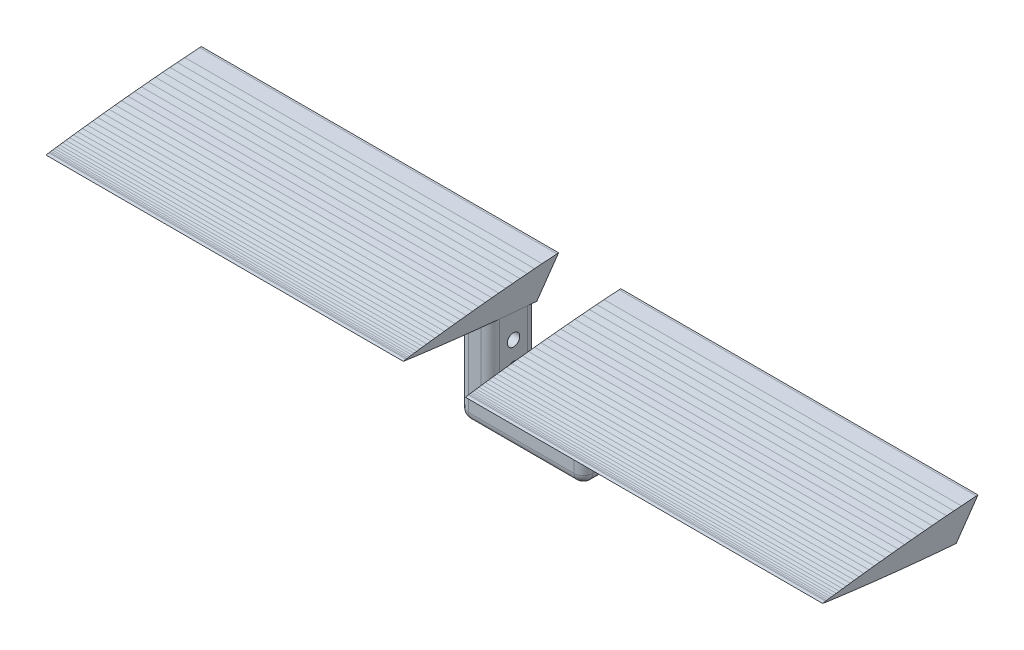
from build123d import *

# Parameters (mm, degrees)
BOSS_EXTRUDE2_DEPTH             = 57.5
SKETCH3_W                       = 5
SKETCH3_H                       = 7.5
BOSS_EXTRUDE3_DEPTH             = 15
BOSS_EXTRUDE3_DIRECTION_2_REACH = 69.5
SKETCH4_W                       = 7.5
SKETCH4_H                       = 5
BOSS_EXTRUDE4_DEPTH             = 5
FILLET1_R                       = 1.5
SKETCH5_R                       = 1
CUT_EXTRUDE1_DEPTH              = 5
MIRROR2_START                   = 5
MIRROR2_DEPTH                   = 57.5
MIRROR2_2_DEPTH                 = 8.5
MIRROR2_START_2                 = 6.5
MIRROR2_3_DEPTH                 = 2
MIRROR2_START_3                 = -15.874411859
MIRROR2_4_DEPTH                 = 14.176143891


with BuildPart() as part:
    # Sketch2 → Boss-Extrude2 (new body)
    with BuildSketch(Plane(origin=(-5, 0, 0), x_dir=(0, 0, -1), z_dir=(1, 0, 0))):
        Polygon((0, 2.626528926), (-3.501696436, -2.374411859), (-3.871666667, -2.345), (-5.056666667, -2.25), (-6.231666667, -2.15), (-7.386666667, -2.045), (-8.526666667, -1.94), (-9.646666667, -1.835), (-10.741666667, -1.725), (-11.811666667, -1.615), (-12.851666667, -1.51), (-13.861666667, -1.4), (-14.841666667, -1.29), (-15.781666667, -1.185), (-16.686666667, -1.08), (-17.551666667, -0.98), (-18.376666667, -0.88), (-19.151666667, -0.785), (-19.886666667, -0.695), (-20.571666667, -0.61), (-21.211666667, -0.525), (-21.796666667, -0.45), (-22.331666667, -0.38), (-22.816666667, -0.315), (-23.246666667, -0.26), (-23.616666667, -0.21), (-23.936666667, -0.165), (-24.196666667, -0.13), (-24.401666667, -0.1), (-24.546666667, -0.08), (-25, 0), (-24.546666667, 0.08), (-24.401666667, 0.1), (-24.196666667, 0.13), (-23.936666667, 0.165), (-23.616666667, 0.21), (-23.246666667, 0.26), (-22.816666667, 0.315), (-22.331666667, 0.38), (-21.796666667, 0.45), (-21.211666667, 0.525), (-20.571666667, 0.61), (-19.886666667, 0.695), (-19.151666667, 0.785), (-18.376666667, 0.88), (-17.551666667, 0.98), (-16.686666667, 1.08), (-15.781666667, 1.185), (-14.841666667, 1.29), (-13.861666667, 1.4), (-12.851666667, 1.51), (-11.811666667, 1.615), (-10.741666667, 1.725), (-9.646666667, 1.835), (-8.526666667, 1.94), (-7.386666667, 2.045), (-6.231666667, 2.15), (-5.056666667, 2.25), (-3.871666667, 2.345), (-2.676666667, 2.44), (-0.266666667, 2.61), align=None)
    extrude(amount=-BOSS_EXTRUDE2_DEPTH)


with BuildPart() as body_2:
    # Sketch3 → Boss-Extrude3 (new body)
    with BuildSketch(Plane(origin=(0, -2.374411859, 0), x_dir=(1, 0, 0), z_dir=(0, 1, 0))):
        with Locations((-7.5, -7.251696436)):
            Rectangle(SKETCH3_W, SKETCH3_H)
    extrude(amount=-BOSS_EXTRUDE3_DEPTH)


    # Sketch3 → Boss-Extrude3 direction 2 (add, up to next)
    with BuildSketch(Plane(origin=(0, -2.374411859, 0), x_dir=(1, 0, 0), z_dir=(0, 1, 0)), mode=Mode.PRIVATE) as boss_extrude3_direction_2_sk1:
        with Locations((-7.5, -7.251696436)):
            Rectangle(SKETCH3_W, SKETCH3_H)
    boss_extrude3_direction_2_tool1 = extrude(boss_extrude3_direction_2_sk1.sketch, amount=BOSS_EXTRUDE3_DIRECTION_2_REACH, mode=Mode.PRIVATE) - part.part
    add(boss_extrude3_direction_2_tool1.solids().sort_by_distance((-7.5, -2.374412, 7.251696))[0])

    # Sketch4 → Boss-Extrude4 (add)
    with BuildSketch(Plane(origin=(-5, 0, 0), x_dir=(0, 0, -1), z_dir=(1, 0, 0))):
        with Locations((-7.251696436, -14.874411859)):
            Rectangle(SKETCH4_W, SKETCH4_H)
    extrude(amount=BOSS_EXTRUDE4_DEPTH)

    # Fillet1
    fillet1_edges = [body_2.edges().sort_by_distance(p)[0] for p in [
        (-2.5, -12.374411859, 11.001696436),
        (-2.5, -12.374411859, 3.501696436),
        (-5, -7.036339914, 11.001696436),
        (-5, -7.374411859, 3.501696436),
        (-5, -17.374411859, 3.501696436),
        (-5, -17.374411859, 11.001696436),
        (-10, -17.374411859, 7.251696436),
        (-10, -9.536339914, 11.001696436),
        (-10, -9.874411859, 3.501696436),
    ]]
    fillet(fillet1_edges, radius=FILLET1_R)

    # Sketch5 → Cut-Extrude1 (cut)
    with BuildSketch(Plane.ZY.offset(10)):
        with Locations((7.251696436, -5.874411859)):
            Circle(SKETCH5_R)
        with Locations((7.251696436, -9.874411859)):
            Circle(SKETCH5_R)
    extrude(amount=-CUT_EXTRUDE1_DEPTH, mode=Mode.SUBTRACT)

    # Mirror2: read off the stored shape, not the designer's step
    # Mirror2 outline → Mirror2 (add)
    with BuildSketch(Plane.YZ.offset(MIRROR2_START)):
        Polygon((-1.615, 11.811666667), (-1.725, 10.741666667), (-1.835, 9.646666667), (-1.848590959, 9.501696436), (-1.94, 8.526666667), (-2.045, 7.386666667), (-2.15, 6.231666667), (-2.25, 5.056666667), (-2.254406896, 5.001696436), (-2.345, 3.871666667), (-2.374411859, 3.501696436), (2.626528926, 0), (2.61, 0.266666667), (2.44, 2.676666667), (2.345, 3.871666667), (2.25, 5.056666667), (2.15, 6.231666667), (2.045, 7.386666667), (1.94, 8.526666667), (1.835, 9.646666667), (1.725, 10.741666667), (1.615, 11.811666667), (1.51, 12.851666667), (1.4, 13.861666667), (1.29, 14.841666667), (1.185, 15.781666667), (1.08, 16.686666667), (0.98, 17.551666667), (0.88, 18.376666667), (0.785, 19.151666667), (0.695, 19.886666667), (0.61, 20.571666667), (0.525, 21.211666667), (0.45, 21.796666667), (0.38, 22.331666667), (0.315, 22.816666667), (0.26, 23.246666667), (0.21, 23.616666667), (0.165, 23.936666667), (0.13, 24.196666667), (0.1, 24.401666667), (0.08, 24.546666667), (0, 25), (-0.08, 24.546666667), (-0.1, 24.401666667), (-0.13, 24.196666667), (-0.165, 23.936666667), (-0.21, 23.616666667), (-0.26, 23.246666667), (-0.315, 22.816666667), (-0.38, 22.331666667), (-0.45, 21.796666667), (-0.525, 21.211666667), (-0.61, 20.571666667), (-0.695, 19.886666667), (-0.785, 19.151666667), (-0.88, 18.376666667), (-0.98, 17.551666667), (-1.08, 16.686666667), (-1.185, 15.781666667), (-1.29, 14.841666667), (-1.4, 13.861666667), (-1.51, 12.851666667), align=None)
    extrude(amount=MIRROR2_DEPTH)

    # Mirror2 2 outline → Mirror2 2 (add)
    with BuildSketch(Plane.YZ):
        with BuildLine():
            Line((-13.874411859, 11.001696436), (-15.874411859, 11.001696436))
            ThreePointArc((-15.874411859, 11.001696436), (-16.935072031, 10.562356608), (-17.374411859, 9.501696436))
            Line((-17.374411859, 9.501696436), (-17.374411859, 5.001696436))
            ThreePointArc((-17.374411859, 5.001696436), (-16.935072031, 3.941036264), (-15.874411859, 3.501696436))
            Line((-15.874411859, 3.501696436), (-13.874411859, 3.501696436))
            ThreePointArc((-13.874411859, 3.501696436), (-12.813751687, 3.941036265), (-12.374411859, 5.001696436))
            Line((-12.374411859, 5.001696436), (-12.374411859, 9.501696436))
            ThreePointArc((-12.374411859, 9.501696436), (-12.813751687, 10.562356607), (-13.874411859, 11.001696436))
        make_face()
    extrude(amount=MIRROR2_2_DEPTH)

    # Mirror2 3 outline → Mirror2 3 (add)
    with BuildSketch(Plane.YZ.offset(MIRROR2_START_2)):
        with BuildLine():
            Line((-1.698267968, 11.001696436), (-13.874411859, 11.001696436))
            ThreePointArc((-13.874411859, 11.001696436), (-12.813751687, 10.562356607), (-12.374411859, 9.501696436))
            Line((-12.374411859, 9.501696436), (-12.374411859, 5.001696436))
            ThreePointArc((-12.374411859, 5.001696436), (-12.813751687, 3.941036265), (-13.874411859, 3.501696436))
            Line((-13.874411859, 3.501696436), (-2.374411859, 3.501696436))
            Line((-2.374411859, 3.501696436), (-2.345, 3.871666667))
            Line((-2.345, 3.871666667), (-2.254406896, 5.001696436))
            Line((-2.254406896, 5.001696436), (-2.25, 5.056666667))
            Line((-2.25, 5.056666667), (-2.15, 6.231666667))
            Line((-2.15, 6.231666667), (-2.045, 7.386666667))
            Line((-2.045, 7.386666667), (-1.94, 8.526666667))
            Line((-1.94, 8.526666667), (-1.848590959, 9.501696436))
            Line((-1.848590959, 9.501696436), (-1.835, 9.646666667))
            Line((-1.835, 9.646666667), (-1.725, 10.741666667))
            Line((-1.725, 10.741666667), (-1.698267968, 11.001696436))
        make_face()
    extrude(amount=MIRROR2_3_DEPTH)

    # Mirror2 4 outline → Mirror2 4 (add)
    with BuildSketch(Plane(origin=(0, 0, 0), x_dir=(1, 0, 0), z_dir=(0, 1, 0)).offset(MIRROR2_START_3)):
        with BuildLine():
            ThreePointArc((6.5, -3.501696436), (5.439339828, -3.941036264), (5, -5.001696436))
            Line((5, -5.001696436), (5, -9.501696436))
            ThreePointArc((5, -9.501696436), (5.439339828, -10.562356608), (6.5, -11.001696436))
            Line((6.5, -11.001696436), (6.5, -3.501696436))
        make_face()
        with BuildLine():
            ThreePointArc((8.5, -11.001696436), (9.560660172, -10.562356608), (10, -9.501696436))
            Line((10, -9.501696436), (10, -5.001696436))
            ThreePointArc((10, -5.001696436), (9.560660172, -3.941036264), (8.5, -3.501696436))
            Line((8.5, -3.501696436), (8.5, -11.001696436))
        make_face()
    extrude(amount=MIRROR2_4_DEPTH)

    # Mirror2 5 outline → Mirror2 5 (revolve)
    with BuildSketch(Plane(origin=(8.5, -15.874411859, 0), x_dir=(1, 0, 0), z_dir=(0, -1, 0))):
        with BuildLine():
            Line((1.5, 5.001696436), (1.5, 9.501696436))
            ThreePointArc((1.5, 9.501696436), (1.060660172, 10.562356608), (0, 11.001696436))
            Line((0, 11.001696436), (0, 3.501696436))
            ThreePointArc((0, 3.501696436), (1.060660172, 3.941036264), (1.5, 5.001696436))
        make_face()
    revolve(axis=Axis((8.5, -15.874411859, 0), (0, 0, 1)))


solid = Compound([part.part, body_2.part])
